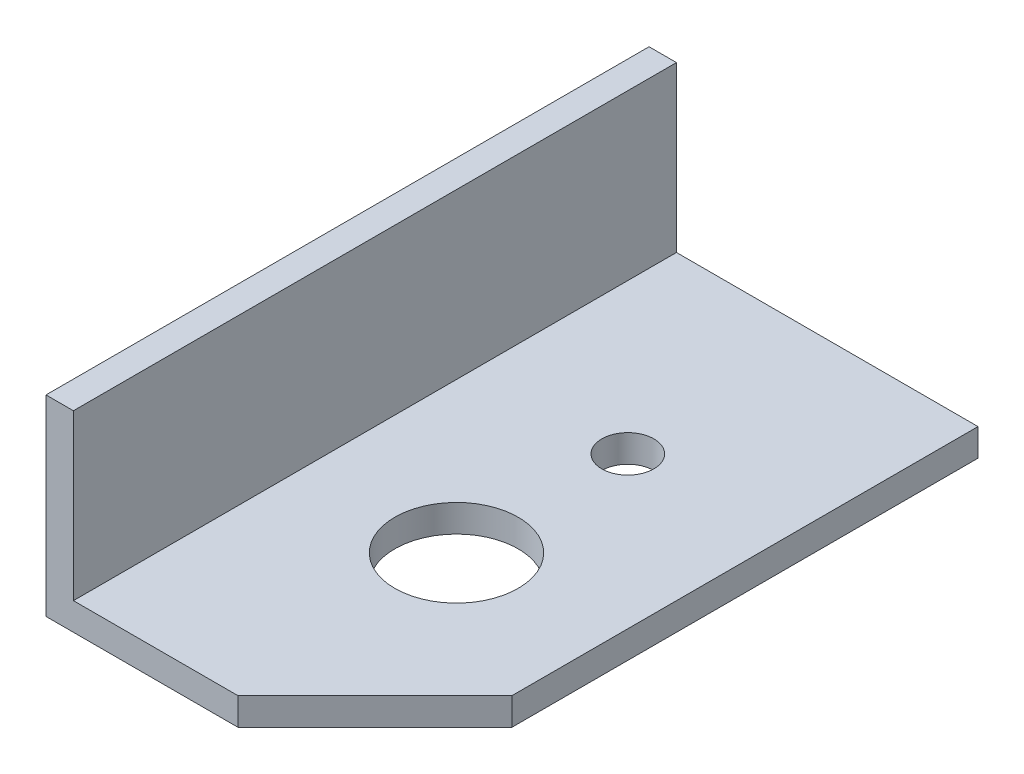
from build123d import *

# Parameters (mm, degrees)
EXTRUDE_1_DEPTH     = 44
SKETCH_4_R          = 1.9
SKETCH_4_R_2        = 4.5
CUT_EXTRUDE_1_DEPTH = 52.536394907
CHAMFER_1_SIZE      = 10


with BuildPart() as part:
    # Эскиз2 → Вытянуть-Тонкостенный1 (new body)
    with BuildSketch(Plane.XY):
        Polygon((24, 0), (0, 0), (0, 14), (2, 14), (2, 2), (24, 2), align=None)
    extrude(amount=EXTRUDE_1_DEPTH)

    # Эскиз4 → Вырез-Вытянуть1 (cut, through all)
    with BuildSketch(Plane(origin=(0, 2, 0), x_dir=(-1, 0, 0), z_dir=(0, 1, 0))):
        with Locations((-12.95, 14.5)):
            Circle(SKETCH_4_R)
        with Locations((-12.95, 27)):
            Circle(SKETCH_4_R_2)
    extrude(amount=-CUT_EXTRUDE_1_DEPTH, mode=Mode.SUBTRACT)

    # Фаска1
    chamfer_1_edges = [part.edges().sort_by_distance(p)[0] for p in [
        (24, 1, 44),
    ]]
    chamfer(chamfer_1_edges, length=CHAMFER_1_SIZE)


solid = part.part
